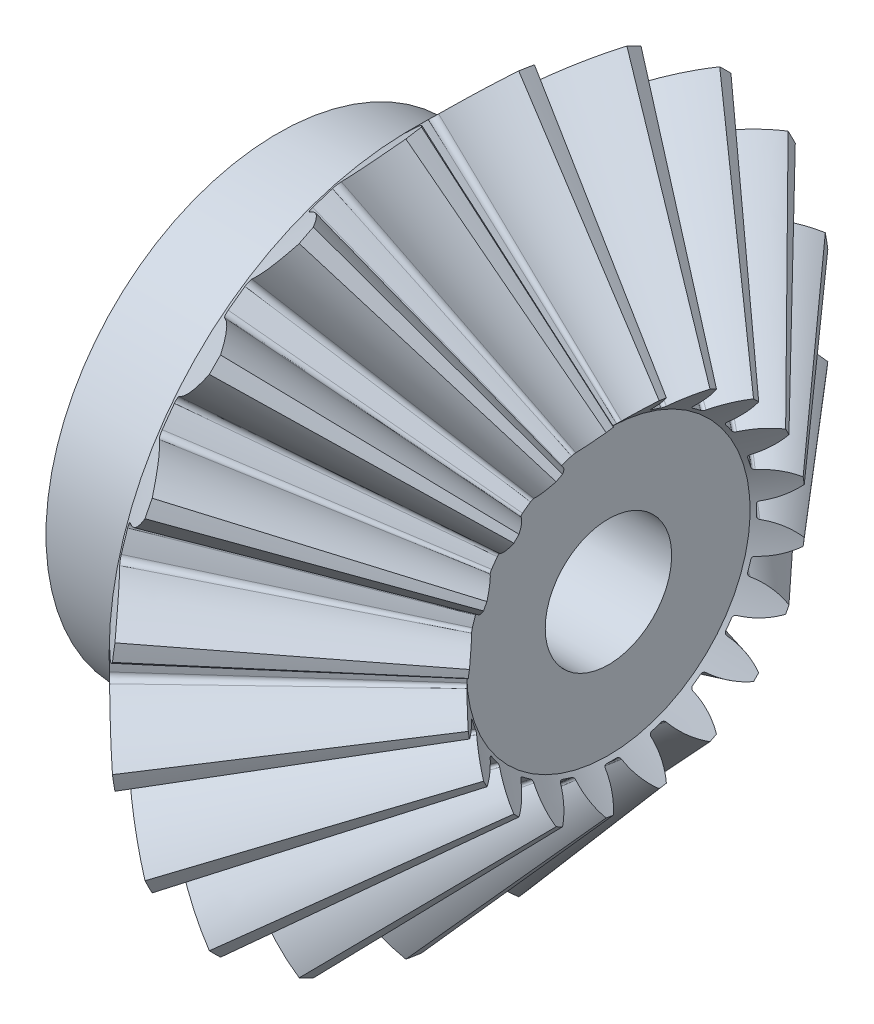
from build123d import *

# Parameters (mm, degrees)
TEETHCUTS_COUNT = 20
TEETHCUTS_ANGLE = 342
HUBSKE_R        = 5.5
HUB_DEPTH       = 3.15917486
BORSKE_R        = 1.5
BORE_DEPTH      = 12.0000508


with BuildPart() as part:
    # BasProSke → Base-Revolve (revolve)
    with BuildSketch(Plane(origin=(0, 0, 0), x_dir=(1, 0, 0), z_dir=(0, 1, 0)), mode=Mode.PRIVATE) as base_revolve_sk:
        Polygon((0, 0), (0, 7.159073261), (1.406612166, 8.565685424), (5.349252849, 4.023044734), (4.688609434, 3.36240132), (4.688609434, 0), align=None)
    revolve(base_revolve_sk.sketch.rotate(Axis((-10, 0, 0), (1, 0, 0)), 180), axis=Axis((-10, 0, 0), (1, 0, 0)))

    # ToothCut: read off the stored shape, not the designer's step
    # ToothCut: loft between two sections, ruled curve by curve
    toothcut_from = [
        Edge.make_bspline([(8.846968182, 0.006041442, -0.009396371), (8.842747294, 0.001820554, -0.014824058), (8.837070599, -0.003856141, -0.014022911), (8.833691402, -0.007235338, -0.007522631)], [0, 0, 0, 0, 1, 1, 1, 1], 3, [1, 0.779607321, 0.779607321, 1]),
        Edge.make_bspline([(8.833691402, -0.007235338, 0.007522631), (8.837070599, -0.003856141, 0.014022911), (8.842747294, 0.001820554, 0.014824058), (8.846968182, 0.006041442, 0.009396371)], [0, 0, 0, 0, 1, 1, 1, 1], 3, [1, 0.779607321, 0.779607321, 1]),
        Edge.make_bspline([(8.833691402, -0.007235338, -0.007522631), (8.833188772, -0.007737968, -0.006555763), (8.832787408, -0.008139332, -0.005498444), (8.832495307, -0.008431433, -0.00437174)], [0, 0, 0, 0, 1, 1, 1, 1], 3, [1, 0.993359051, 0.993359051, 1]),
        Edge.make_bspline([(8.832495307, -0.008431433, 0.00437174), (8.832787408, -0.008139332, 0.005498444), (8.833188772, -0.007737968, 0.006555763), (8.833691402, -0.007235338, 0.007522631)], [0, 0, 0, 0, 1, 1, 1, 1], 3, [1, 0.993359051, 0.993359051, 1]),
        Edge.make_bspline([(8.832495307, -0.008431433, -0.00437174), (8.831755763, -0.009170977, -0.001519142), (8.831755763, -0.009170977, 0.001519142), (8.832495307, -0.008431433, 0.00437174)], [0, 0, 0, 0, 1, 1, 1, 1], 3, [1, 0.959256539, 0.959256539, 1]),
        Edge.make_line((8.846968182, 0.006041442, 0.009396371), (8.846968182, 0.006041442, -0.009396371)),
    ]
    toothcut_to = [
        Edge.make_bspline([(1.46556069, 8.624633948, -1.28623016), (1.133128031, 8.29220129, -0.817842922), (0.716323315, 7.875396575, -0.512954078), (0.25391972, 7.412992981, -0.399925851)], [0, 0, 0, 0, 1, 1, 1, 1], 3, [1, 0.968991732, 0.968991732, 1]),
        Edge.make_bspline([(0.25391972, 7.412992981, 0.399925851), (0.716323315, 7.875396575, 0.512954078), (1.133128031, 8.29220129, 0.817842922), (1.46556069, 8.624633948, 1.28623016)], [0, 0, 0, 0, 1, 1, 1, 1], 3, [1, 0.968991732, 0.968991732, 1]),
        Edge.make_bspline([(0.25391972, 7.412992981, -0.399925851), (0.198607772, 7.357681033, -0.386405603), (0.16320738, 7.322280641, -0.324800046), (0.165162164, 7.324235425, -0.245465452)], [0, 0, 0, 0, 1, 1, 1, 1], 3, [1, 0.835749277, 0.835749277, 1]),
        Edge.make_bspline([(0.165162164, 7.324235425, 0.245465452), (0.16320738, 7.322280641, 0.324800046), (0.198607772, 7.357681033, 0.386405603), (0.25391972, 7.412992981, 0.399925851)], [0, 0, 0, 0, 1, 1, 1, 1], 3, [1, 0.835749277, 0.835749277, 1]),
        Edge.make_bspline([(0.165162164, 7.324235425, -0.245465452), (0.169193484, 7.328266745, -0.081854918), (0.169193484, 7.328266745, 0.081854918), (0.165162164, 7.324235425, 0.245465452)], [0, 0, 0, 0, 1, 1, 1, 1], 3, [1, 0.999595624, 0.999595624, 1]),
        Edge.make_line((1.46556069, 8.624633948, 1.28623016), (1.46556069, 8.624633948, -1.28623016)),
    ]
    toothcut = Solid(Shell([*[Face.make_surface_from_curves(toothcut_from[k], toothcut_to[k]) for k in range(6)], Face(Wire(toothcut_from)), Face(Wire(toothcut_to))]))
    add(toothcut, mode=Mode.SUBTRACT)

    # TeethCuts: ToothCut ×20 about axis
    teethcuts_axis = Axis((-10, 0, 0), (1, 0, 0))
    for i in range(1, TEETHCUTS_COUNT):
        add(toothcut.rotate(teethcuts_axis, i * TEETHCUTS_ANGLE / (TEETHCUTS_COUNT - 1)), mode=Mode.SUBTRACT)

    # HubSke → Hub (add)
    with BuildSketch(Plane.ZY):
        with Locations(Location((0, 0, 0), (0, 0, 180))):
            Circle(HUBSKE_R)
    extrude(amount=HUB_DEPTH)

    # BorSke → Bore (cut, symmetric)
    with BuildSketch(Plane(origin=(0, 0, 0), x_dir=(0, 0, -1), z_dir=(1, 0, 0))):
        with Locations(Location((0, 0, 0), (0, 0, 180))):
            Circle(BORSKE_R)
    extrude(amount=BORE_DEPTH, both=True, mode=Mode.SUBTRACT)


solid = part.part
